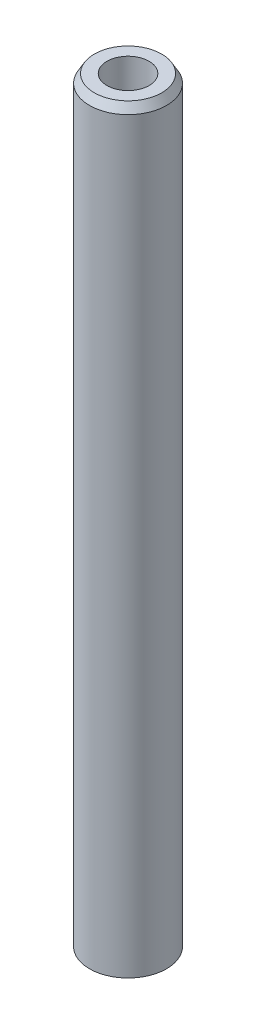
from build123d import *
from OCP.BRepFilletAPI import BRepFilletAPI_MakeChamfer

# Parameters (mm, degrees)
SKETCH1_R           = 25
BOSS_EXTRUDE1_DEPTH = 493.757873071
SKETCH2_R           = 13.673113852
CUT_EXTRUDE1_DEPTH  = 496.022057306
CHAMFER1_SIZE       = 5.512839612
CHAMFER1_SIZE2      = 3.182839434


with BuildPart() as part:
    # Sketch1 → Boss-Extrude1 (new body)
    with BuildSketch(Plane(origin=(0, 0, 0), x_dir=(1, 0, 0), z_dir=(0, 1, 0))):
        Circle(SKETCH1_R)
    extrude(amount=BOSS_EXTRUDE1_DEPTH)

    # Sketch2 → Cut-Extrude1 (cut, through all)
    with BuildSketch(Plane(origin=(0, 0, 0), x_dir=(1, 0, 0), z_dir=(0, 1, 0))):
        Circle(SKETCH2_R)
    extrude(amount=CUT_EXTRUDE1_DEPTH, mode=Mode.SUBTRACT)

    # Chamfer1: one chamfer whose edges measure the first distance from different faces: ONE call of the kernel's chamfer builder (chamfer() names one face for all edges)
    chamfer1_edges_1 = [part.edges().sort_by_distance(p)[0] for p in [
        (-25, 493.757873071, 0),
    ]]
    chamfer1_side_1 = [part.faces().sort_by_distance(p)[0] for p in [
        (-25, 246.878936536, 0),
    ]]
    chamfer1_edges_2 = [part.edges().sort_by_distance(p)[0] for p in [
        (-25, 0, 0),
    ]]
    chamfer1_side_2 = [part.faces().sort_by_distance(p)[0] for p in [
        (-24.292893219, 0, 0),
    ]]
    chamfer1 = BRepFilletAPI_MakeChamfer(part.part.solid().wrapped)
    for e in chamfer1_edges_1:
        chamfer1.Add(CHAMFER1_SIZE, CHAMFER1_SIZE2, e.wrapped, chamfer1_side_1[0].wrapped)  # the first distance lies on this face
    for e in chamfer1_edges_2:
        chamfer1.Add(CHAMFER1_SIZE, CHAMFER1_SIZE2, e.wrapped, chamfer1_side_2[0].wrapped)  # the first distance lies on this face
    add(Compound.cast(chamfer1.Shape()), mode=Mode.REPLACE)


solid = part.part
